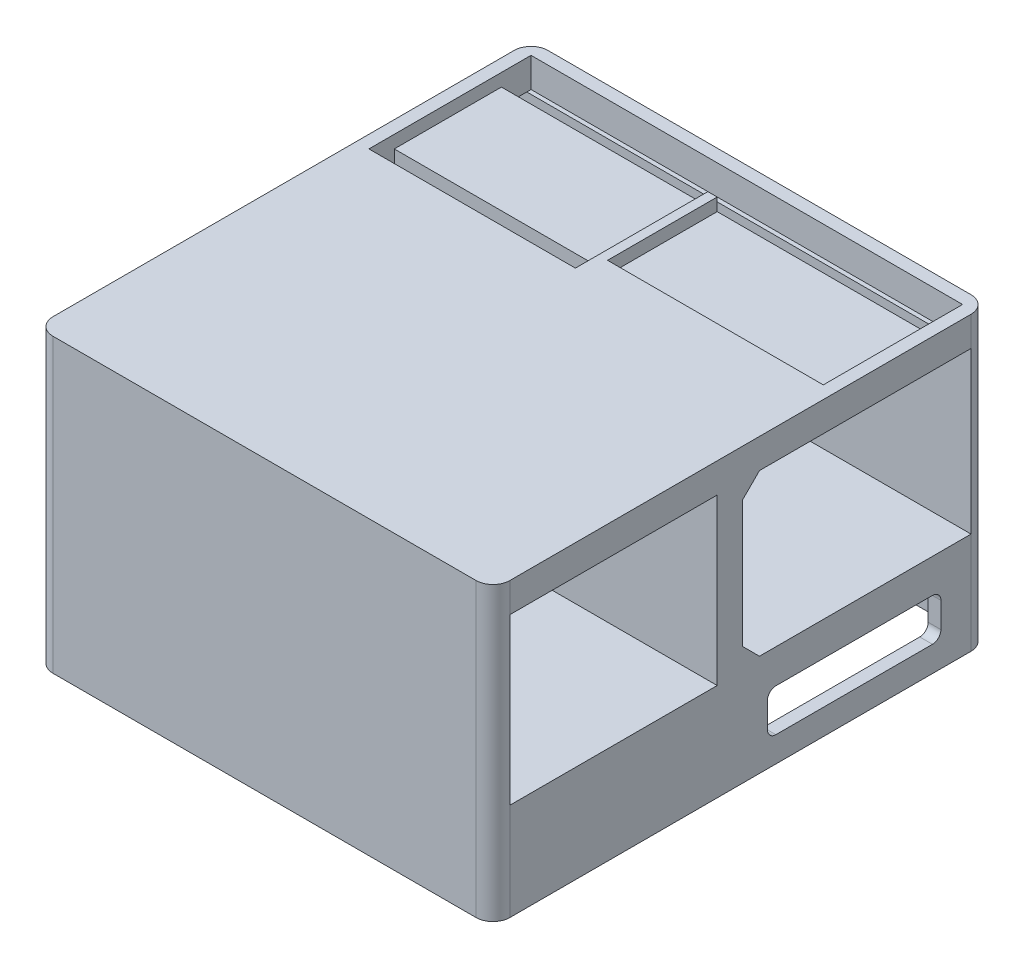
from build123d import *

# Parameters (mm, degrees)
BOSS_EXTRUDE4_DEPTH = 21
BOSS_EXTRUDE5_START = 3.5
BOSS_EXTRUDE5_DEPTH = 3.5
SKETCH4_W           = 27
SKETCH4_H           = 19
CUT_EXTRUDE4_DEPTH  = 72.268857154
SKETCH3_5_W         = 24.4
SKETCH3_5_H         = 12.66
BOSS_EXTRUDE6_DEPTH = 2
SKETCH5_W           = 51
SKETCH5_H           = 30
BOSS_EXTRUDE7_DEPTH = 10
CUT_EXTRUDE5_DEPTH  = 75.828136419
CUT_EXTRUDE6_REACH  = 76.828
SKETCH8_W           = 24.5
SKETCH8_H           = 19.5
CHAMFER1_SIZE       = 2


with BuildPart() as part:
    # Sketch3 → Boss-Extrude4 (new body)
    with BuildSketch(Plane(origin=(0, 0, 0), x_dir=(1, 0, 0), z_dir=(0, 1, 0))):
        with BuildLine():
            Line((-27, 15), (-27, -39.5))
            ThreePointArc((-27, -39.5), (-26.414213562, -40.914213562), (-25, -41.5))
            Line((-25, -41.5), (25, -41.5))
            ThreePointArc((25, -41.5), (26.414213562, -40.914213562), (27, -39.5))
            Line((27, -39.5), (27, 15))
            ThreePointArc((27, 15), (26.414213562, 16.414213562), (25, 17))
            Line((25, 17), (-25, 17))
            ThreePointArc((-25, 17), (-26.414213562, 16.414213562), (-27, 15))
        make_face()
    extrude(amount=-BOSS_EXTRUDE4_DEPTH)

    # Sketch3<3> → Boss-Extrude5 (add)
    with BuildSketch(Plane(origin=(0, 0, 0), x_dir=(1, 0, 0), z_dir=(0, 1, 0)).offset(BOSS_EXTRUDE5_START)):
        with BuildLine():
            Line((-27, 15), (-27, -39.5))
            ThreePointArc((-27, -39.5), (-26.414213562, -40.914213562), (-25, -41.5))
            Line((-25, -41.5), (25, -41.5))
            ThreePointArc((25, -41.5), (26.414213562, -40.914213562), (27, -39.5))
            Line((27, -39.5), (27, 15))
            ThreePointArc((27, 15), (26.414213562, 16.414213562), (25, 17))
            Line((25, 17), (-25, 17))
            ThreePointArc((-25, 17), (-26.414213562, 16.414213562), (-27, 15))
        make_face()
        Polygon((0, 12), (-1.1, 12), (-1.1, -3.66), (-25.5, -3.66), (-25.5, 15.5), (25.5, 15.5), (25.5, -0.96), (0, -0.96), align=None, mode=Mode.SUBTRACT)
    extrude(amount=-BOSS_EXTRUDE5_DEPTH)

    # Sketch4 → Cut-Extrude4 (cut, through all)
    with BuildSketch(Plane.ZY.offset(27)):
        with Locations((-1.5, -9.5)):
            Rectangle(SKETCH4_W, SKETCH4_H)
    extrude(amount=-CUT_EXTRUDE4_DEPTH, mode=Mode.SUBTRACT)

    # Sketch3<5> → Boss-Extrude6 (add)
    with BuildSketch(Plane(origin=(0, 0, 0), x_dir=(1, 0, 0), z_dir=(0, 1, 0))):
        with Locations((-13.3, 5.67)):
            Rectangle(SKETCH3_5_W, SKETCH3_5_H)
        Polygon((25.5, 12), (0, 12), (0, -0.96), (25.5, -0.96), (25.5, -0.5), align=None)
    extrude(amount=BOSS_EXTRUDE6_DEPTH)

    # Sketch5 → Boss-Extrude7 (add)
    # profile 1 of 2: a face of its own
    with BuildSketch(Plane.XZ.offset(21)):
        with BuildLine():
            ThreePointArc((25, -17), (26.414213562, -16.414213562), (27, -15))
            Line((27, -15), (27, 39.5))
            ThreePointArc((27, 39.5), (26.414213562, 40.914213562), (25, 41.5))
            Line((25, 41.5), (-25, 41.5))
            ThreePointArc((-25, 41.5), (-26.414213562, 40.914213562), (-27, 39.5))
            Line((-27, 39.5), (-27, -15))
            ThreePointArc((-27, -15), (-26.414213562, -16.414213562), (-25, -17))
            Line((-25, -17), (25, -17))
        make_face()
        with Locations((0, -1.5)):
            Rectangle(SKETCH5_W, SKETCH5_H, mode=Mode.SUBTRACT)
    # profile 2 of 2: a face of its own
    with BuildSketch(Plane.XZ.offset(21)):
        with BuildLine():
            ThreePointArc((25, -17), (26.414213562, -16.414213562), (27, -15))
            Line((27, -15), (27, 39.5))
            ThreePointArc((27, 39.5), (26.414213562, 40.914213562), (25, 41.5))
            Line((25, 41.5), (-25, 41.5))
            ThreePointArc((-25, 41.5), (-26.414213562, 40.914213562), (-27, 39.5))
            Line((-27, 39.5), (-27, -15))
            ThreePointArc((-27, -15), (-26.414213562, -16.414213562), (-25, -17))
            Line((-25, -17), (25, -17))
        make_face()
        with Locations((0, -1.5)):
            Rectangle(SKETCH5_W, SKETCH5_H, mode=Mode.SUBTRACT)
    extrude(amount=BOSS_EXTRUDE7_DEPTH)

    # Sketch6 → Cut-Extrude5 (cut, through all)
    with BuildSketch(Plane.ZY.offset(27)):
        with BuildLine():
            Line((-10.438825699, -23), (8.061174301, -23))
            ThreePointArc((8.061174301, -23), (8.768281082, -23.292893219), (9.061174301, -24))
            Line((9.061174301, -24), (9.061174301, -27))
            ThreePointArc((9.061174301, -27), (8.768281082, -27.707106781), (8.061174301, -28))
            Line((8.061174301, -28), (-10.438825699, -28))
            ThreePointArc((-10.438825699, -28), (-11.14593248, -27.707106781), (-11.438825699, -27))
            Line((-11.438825699, -27), (-11.438825699, -24))
            ThreePointArc((-11.438825699, -24), (-11.14593248, -23.292893219), (-10.438825699, -23))
        make_face()
    extrude(amount=-CUT_EXTRUDE5_DEPTH, mode=Mode.SUBTRACT)

    # Sketch8 → Cut-Extrude6 (cut, up to next)
    with BuildSketch(Plane(origin=(27, 0, 0), x_dir=(0, 0, -1), z_dir=(1, 0, 0)), mode=Mode.PRIVATE) as cut_extrude6_sk1:
        with Locations((-27.25, -9.75)):
            Rectangle(SKETCH8_W, SKETCH8_H)
    cut_extrude6_tool1 = extrude(cut_extrude6_sk1.sketch, amount=-CUT_EXTRUDE6_REACH, mode=Mode.PRIVATE) & part.part
    add(cut_extrude6_tool1.solids().sort_by_distance((27, -9.75, 27.25))[0], mode=Mode.SUBTRACT)

    # Chamfer1
    chamfer1_edges = [part.edges().sort_by_distance(p)[0] for p in [
        (25.5, -26, -16.5),
        (-25.5, -21, -1.5),
        (-25.5, -26, -16.5),
        (0, -21, 13.5),
        (-25.5, -26, 13.5),
        (25.5, -26, 13.5),
        (0, -21, -16.5),
        (25.5, -21, -1.5),
        (0, 0, 12),
        (0, -19, 12),
    ]]
    chamfer(chamfer1_edges, length=CHAMFER1_SIZE - 0.0001)  # a hair under: the kernel refuses the full size


solid = part.part
